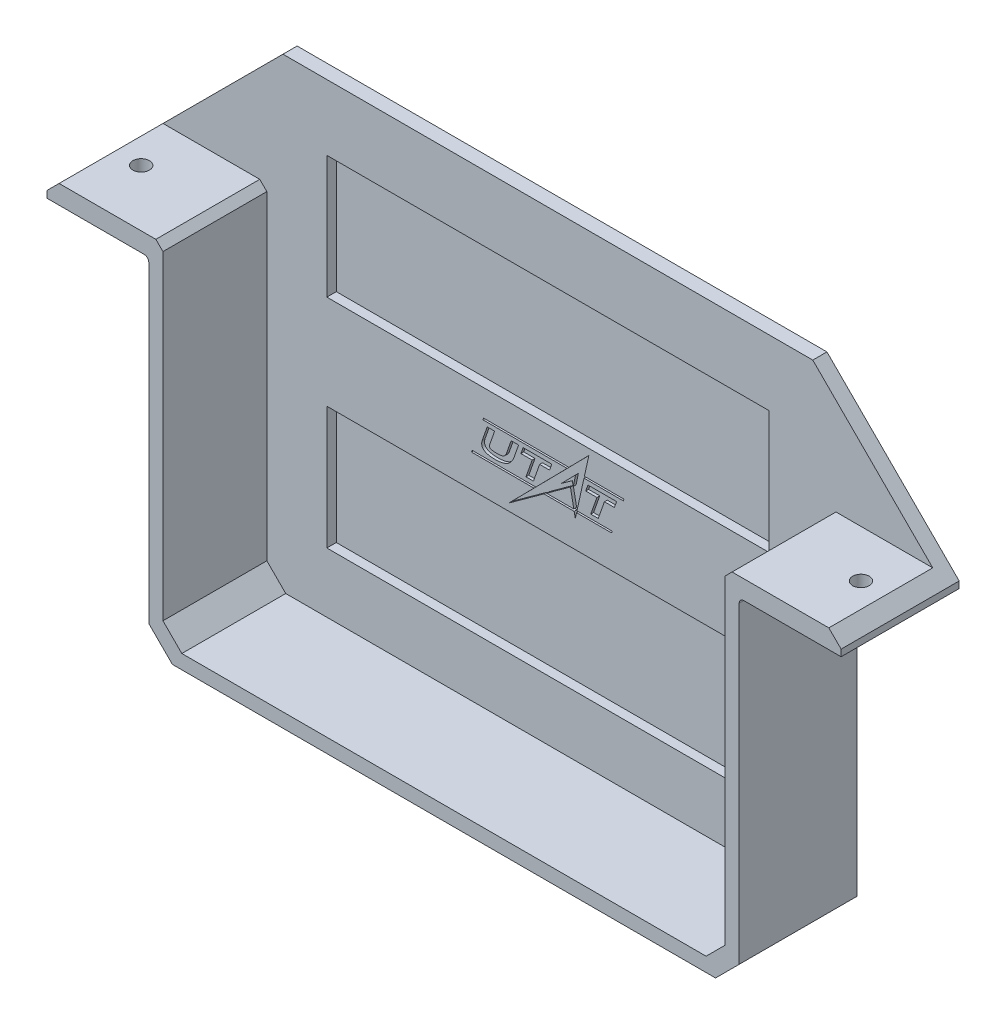
from build123d import *

# Parameters (mm, degrees)
SKETCH1_W           = 125
SKETCH1_H           = 76.2
BOSS_EXTRUDE1_DEPTH = 3
SKETCH2_W           = 3
SKETCH2_H           = 76.2
BOSS_EXTRUDE2_DEPTH = 22
SKETCH4_W           = 25
SKETCH4_H           = 4
BOSS_EXTRUDE4_DEPTH = 21.59
SKETCH5_W           = 25
SKETCH5_H           = 4
BOSS_EXTRUDE5_DEPTH = 21.59
SKETCH6_W           = 168.18
SKETCH6_H           = 25.4
BOSS_EXTRUDE6_DEPTH = 3
CHAMFER1_SIZE       = 28
SKETCH7_W           = 93.6
SKETCH7_H           = 26
CUT_EXTRUDE1_DEPTH  = 2
SKETCH9_W           = 119
SKETCH9_H           = 3
BOSS_EXTRUDE7_DEPTH = 22
CHAMFER2_SIZE       = 4
CHAMFER3_SIZE       = 5
CUT_EXTRUDE2_START  = -0.6
CUT_EXTRUDE2_DEPTH  = 0.6
SKETCH11_R          = 1.75
CUT_EXTRUDE3_DEPTH  = 5
FILLET1_R           = 1
CHAMFER4_SIZE       = 1.5


# Read off the part's stored shape, not the designer's step: Cut-Extrude2
with BuildPart() as part:
    # Sketch1 → Boss-Extrude1 (new body)
    with BuildSketch(Plane.XY):
        Rectangle(SKETCH1_W, SKETCH1_H)
    extrude(amount=BOSS_EXTRUDE1_DEPTH)

    # Sketch2 → Boss-Extrude2 (add)
    with BuildSketch(Plane.XY.offset(3)):
        with Locations((-61, 0)):
            Rectangle(SKETCH2_W, SKETCH2_H)
        with Locations((61, 0)):
            Rectangle(SKETCH2_W, SKETCH2_H)
    extrude(amount=BOSS_EXTRUDE2_DEPTH)

    # Sketch4 → Boss-Extrude4 (add)
    with BuildSketch(Plane.ZY.offset(62.5)):
        with Locations((12.5, 36.1)):
            Rectangle(SKETCH4_W, SKETCH4_H)
    extrude(amount=BOSS_EXTRUDE4_DEPTH)

    # Sketch5 → Boss-Extrude5 (add)
    with BuildSketch(Plane(origin=(62.5, 0, 0), x_dir=(0, 0, -1), z_dir=(1, 0, 0))):
        with Locations((-12.5, 36.1)):
            Rectangle(SKETCH5_W, SKETCH5_H)
    extrude(amount=BOSS_EXTRUDE5_DEPTH)

    # Sketch6 → Boss-Extrude6 (add)
    with BuildSketch(Plane(origin=(0, 0, 0), x_dir=(-1, 0, 0), z_dir=(0, 0, -1))):
        with Locations((0, 50.8)):
            Rectangle(SKETCH6_W, SKETCH6_H)
    extrude(amount=-BOSS_EXTRUDE6_DEPTH)

    # Chamfer1
    chamfer1_edges = [part.edges().sort_by_distance(p)[0] for p in [
        (-84.09, 63.5, 1.5),
        (84.09, 63.5, 1.5),
    ]]
    chamfer(chamfer1_edges, length=CHAMFER1_SIZE)

    # Sketch7 → Cut-Extrude1 (cut)
    with BuildSketch(Plane.XY.offset(3)):
        with Locations((0, -9.4)):
            Rectangle(SKETCH7_W, SKETCH7_H)
        with Locations((0, 36.6)):
            Rectangle(SKETCH7_W, SKETCH7_H)
    extrude(amount=-CUT_EXTRUDE1_DEPTH, mode=Mode.SUBTRACT)

    # Sketch9 → Boss-Extrude7 (add)
    with BuildSketch(Plane.XY.offset(3)):
        with Locations((0, -36.6)):
            Rectangle(SKETCH9_W, SKETCH9_H)
    extrude(amount=BOSS_EXTRUDE7_DEPTH)

    # Chamfer2
    chamfer2_edges = [part.edges().sort_by_distance(p)[0] for p in [
        (-59.5, -35.1, 14),
        (59.5, -35.1, 14),
    ]]
    chamfer(chamfer2_edges, length=CHAMFER2_SIZE)

    # Chamfer3
    chamfer3_edges = [part.edges().sort_by_distance(p)[0] for p in [
        (62.5, -38.1, 12.5),
        (-62.5, -38.1, 12.5),
    ]]
    chamfer(chamfer3_edges, length=CHAMFER3_SIZE)

    # Cut-Extrude2 outline → Cut-Extrude2 (cut)
    # profile 1 of 4: a face of its own
    with BuildSketch(Plane.XY.offset(3).offset(CUT_EXTRUDE2_START)):
        with BuildLine():
            Line((-12.843793417, 16.784775128), (-13.918894641, 13.722312614))
            add(Edge.make_bspline(
                [(-13.918894641, 13.722312614), (-13.950745906, 13.608646354), (-13.97919001, 13.483685694), (-14.011317489, 13.235305925), (-14.01541758, 13.110841548), (-13.989547543, 12.867284383), (-13.959604678, 12.747961158), (-13.857332343, 12.519974586), (-13.78490702, 12.411398187), (-13.592313629, 12.212018271), (-13.472083062, 12.121314997), (-13.184369222, 11.962818623), (-13.016909084, 11.895027419), (-12.454211206, 11.728033285), (-11.997806272, 11.664794493), (-11.025815686, 11.62704002), (-10.511530183, 11.651603075), (-9.78258436, 11.770518687), (-9.546683753, 11.824200176), (-9.102156978, 11.962599668), (-8.89364967, 12.047436893), (-8.514064046, 12.246658938), (-8.343153207, 12.361026326), (-8.04132547, 12.611058926), (-7.910418089, 12.746448479), (-7.679883041, 13.0275306), (-7.579636344, 13.172799488), (-7.44297026, 13.39668043), (-7.39971151, 13.472431032), (-7.318663078, 13.627460279), (-7.280772846, 13.706786212), (-7.248185858, 13.788667895)],
                knots=[0, 0, 0, 0, 0.0625, 0.0625, 0.125, 0.125, 0.1875, 0.1875, 0.25, 0.25, 0.3125, 0.3125, 0.375, 0.375, 0.5, 0.5, 0.625, 0.625, 0.6875, 0.6875, 0.75, 0.75, 0.8125, 0.8125, 0.875, 0.875, 0.9375, 0.9375, 0.96875, 0.96875, 1, 1, 1, 1], degree=3))
            Line((-7.248185858, 13.788667895), (-6.196379448, 16.784775128))
            Line((-6.196379448, 16.784775128), (-7.771512854, 16.784775171))
            Line((-7.771512854, 16.784775171), (-8.779640442, 13.913087848))
            add(Edge.make_bspline(
                [(-8.779640442, 13.913087848), (-8.801212863, 13.867686768), (-8.828630281, 13.811426743), (-8.890437912, 13.684919137), (-8.925723343, 13.615289873), (-9.014867696, 13.477778317), (-9.069034752, 13.410065742), (-9.20356673, 13.286811644), (-9.283951715, 13.231246188), (-9.470687062, 13.136081945), (-9.576947425, 13.096402347), (-9.809000897, 13.032201026), (-9.934689567, 13.00760449), (-10.326953956, 12.952228061), (-10.607716868, 12.939250309), (-11.138236784, 12.940792557), (-11.387946526, 12.95495502), (-11.815776289, 13.010911905), (-11.994686961, 13.05312605), (-12.19022456, 13.154353945), (-12.243244201, 13.194586759), (-12.322270156, 13.289978248), (-12.348136332, 13.345299657), (-12.373130151, 13.46826163), (-12.371956966, 13.5361378), (-12.35254935, 13.67085438), (-12.333771283, 13.737944141), (-12.322165603, 13.788667937)],
                knots=[0, 0, 0, 0, 0.0625, 0.0625, 0.125, 0.125, 0.1875, 0.1875, 0.25, 0.25, 0.3125, 0.3125, 0.375, 0.375, 0.5, 0.5, 0.625, 0.625, 0.75, 0.75, 0.8125, 0.8125, 0.875, 0.875, 0.9375, 0.9375, 1, 1, 1, 1], degree=3))
            Line((-12.322165603, 13.788667937), (-11.2703582, 16.784775128))
            Line((-11.2703582, 16.784775128), (-12.843793417, 16.784775128))
        make_face()
    # profile 2 of 4: a face of its own
    with BuildSketch(Plane.XY.offset(3).offset(CUT_EXTRUDE2_START)):
        Polygon((14.082145905, 15.466432145), (14.547318434, 16.784775128), (8.481425261, 16.784775128), (8.015662645, 15.45803385), (10.386127447, 15.45803385), (9.075451111, 11.743439605), (10.661733364, 11.743439605), (11.975372051, 15.466432145), align=None)
    # profile 3 of 4: a face of its own
    with BuildSketch(Plane.XY.offset(3).offset(CUT_EXTRUDE2_START)):
        Polygon((0.359928822, 15.45803385), (0.825593089, 16.784775128), (-5.237786258, 16.784775128), (-5.705919648, 15.45803385), (-3.328357423, 15.45803385), (-4.639000977, 11.723834147), (-3.059652234, 11.723834147), (-1.74900868, 15.45803385), align=None)
    # profile 4 of 4: a face of its own
    with BuildSketch(Plane.XY.offset(3).offset(CUT_EXTRUDE2_START)):
        Polygon((7.732615088, 18.009820452), (8.67993853, 22.298690548), (4.451236342, 18.010625114), (-13.617285872, 18.010625114), (-13.760696138, 17.631800344), (4.083976363, 17.631800344), (-2.561139847, 10.89339914), (-16.036862666, 10.89339914), (-16.175076152, 10.505618026), (-2.943552817, 10.505618026), (-8.264964605, 5.10950355), (-0.819885517, 10.505618026), (5.569839691, 10.505618026), (5.813932632, 9.32327198), (6.07620201, 10.510665049), (13.482070183, 10.510665049), (13.624063348, 10.89339914), (6.160742258, 10.89339914), (7.649117922, 17.631800344), (15.972876762, 17.631800344), (16.113123511, 18.009820452), align=None)
        Polygon((-0.283933962, 10.894070437), (4.780674194, 14.564845582), (5.489286994, 10.894070437), align=None, mode=Mode.SUBTRACT)
        Polygon((5.863139247, 17.323666682), (5.364033793, 14.945937564), (5.179256414, 15.9244998), (2.885975157, 14.289472868), align=None, mode=Mode.SUBTRACT)
    extrude(amount=CUT_EXTRUDE2_DEPTH, mode=Mode.SUBTRACT)

    # Sketch11 → Cut-Extrude3 (cut)
    with BuildSketch(Plane(origin=(0, 38.1, 0), x_dir=(1, 0, 0), z_dir=(0, 1, 0))):
        with Locations(Location((-76.11, -13, 0), (0, 0, 270))):
            Circle(SKETCH11_R)
        with Locations(Location((76.29, -13, 0), (0, 0, 270))):
            Circle(SKETCH11_R)
    extrude(amount=-CUT_EXTRUDE3_DEPTH, mode=Mode.SUBTRACT)

    # Fillet1
    fillet1_edges = [part.edges().sort_by_distance(p)[0] for p in [
        (-62.5, 34.1, 12.5),
        (62.5, 34.1, 12.5),
    ]]
    fillet(fillet1_edges, radius=FILLET1_R)

    # Chamfer4
    chamfer4_edges = [part.edges().sort_by_distance(p)[0] for p in [
        (-59.5, 38.1, 14),
        (59.5, 38.1, 14),
    ]]
    chamfer(chamfer4_edges, length=CHAMFER4_SIZE)


solid = part.part
